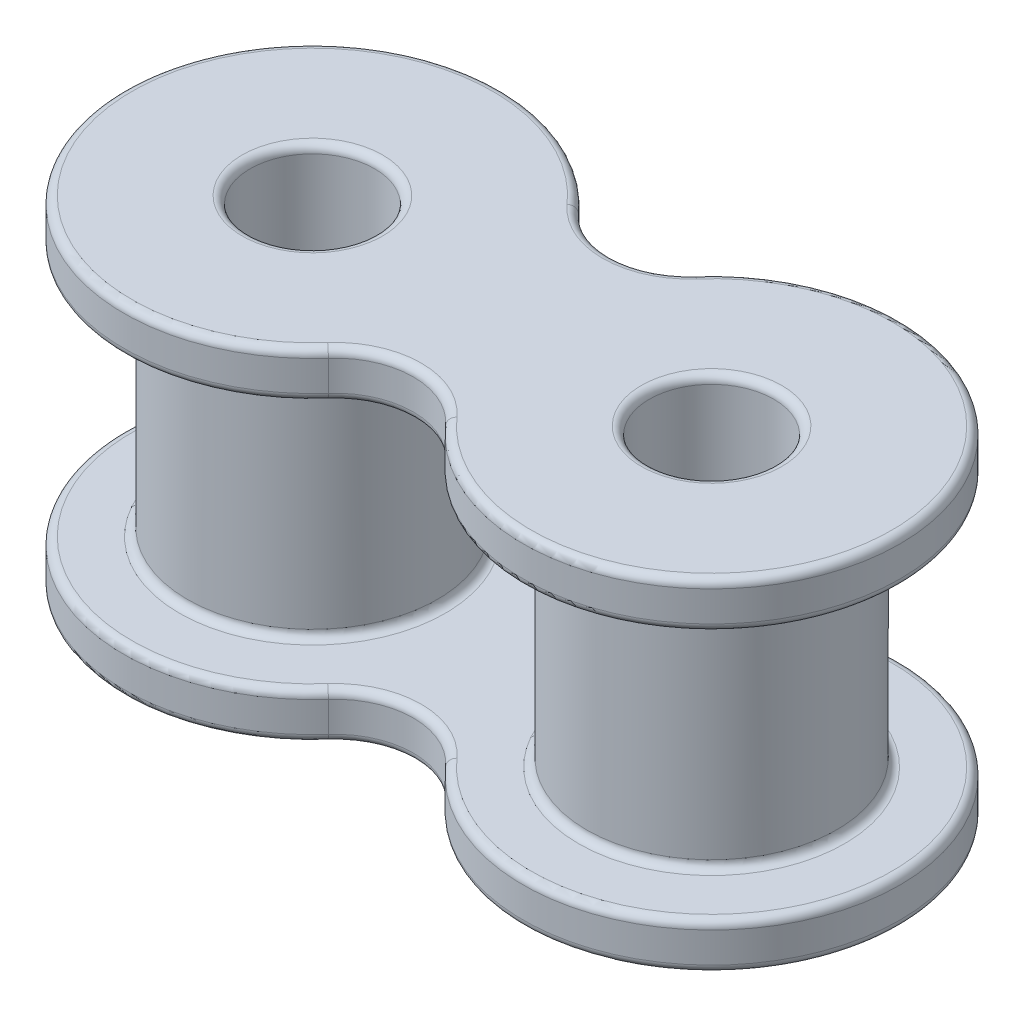
from build123d import *

# Parameters (mm, degrees)
SKETCH1_R             = 1.9812
BOSS_EXTRUDE1_DEPTH   = 0.7366
SKETCH5_R             = 3.9751
SKETCH5_R_2           = 1.9812
BOSS_EXTRUDE2_DEPTH   = 7.9248
FILLET_2_R            = 0.254
FILLET_2_OF_MIRROR2_R = 0.254


with BuildPart() as part:
    # Sketch1 → Boss-Extrude1 (new, symmetric)
    with BuildSketch(Plane(origin=(0, 0, 0), x_dir=(1, 0, 0), z_dir=(0, 1, 0))):
        with BuildLine():
            ThreePointArc((-1.865444619, 3.977636785), (-12.3444, 0), (-1.865444619, -3.977636785))
            ThreePointArc((-1.865444619, -3.977636785), (0, -3.138721939), (1.865444619, -3.977636785))
            ThreePointArc((1.865444619, -3.977636785), (12.3444, 0), (1.865444619, 3.977636785))
            ThreePointArc((1.865444619, 3.977636785), (0, 3.138721939), (-1.865444619, 3.977636785))
        make_face()
        with Locations((-6.35, 0)):
            Circle(SKETCH1_R, mode=Mode.SUBTRACT)
        with Locations((6.35, 0)):
            Circle(SKETCH1_R, mode=Mode.SUBTRACT)
    boss_extrude1 = extrude(amount=BOSS_EXTRUDE1_DEPTH, both=True)

    # Sketch5 → Boss-Extrude2 (add)
    # profile 1 of 2: a face of its own
    with BuildSketch(Plane(origin=(0, 0.7366, 0), x_dir=(1, 0, 0), z_dir=(0, 1, 0))):
        with Locations((6.35, 0)):
            Circle(SKETCH5_R)
        with Locations((6.35, 0)):
            Circle(SKETCH5_R_2, mode=Mode.SUBTRACT)
    # profile 2 of 2: a face of its own
    with BuildSketch(Plane(origin=(0, 0.7366, 0), x_dir=(1, 0, 0), z_dir=(0, 1, 0))):
        with Locations((-6.35, 0)):
            Circle(SKETCH5_R)
        with Locations((-6.35, 0)):
            Circle(SKETCH5_R_2, mode=Mode.SUBTRACT)
    extrude(amount=BOSS_EXTRUDE2_DEPTH)

    # Fillet 2
    fillet_2_edges = [part.edges().sort_by_distance(p)[0] for p in [
        (0, 0.7366, -3.138721939),
        (12.3444, 0.7366, 0),
        (0, 0.7366, 3.138721939),
        (-12.3444, -0.7366, 0),
        (0, -0.7366, -3.138721939),
        (-12.3444, 0.7366, 0),
        (4.3688, -0.7366, 0),
        (-8.3312, -0.7366, 0),
        (0, -0.7366, 3.138721939),
        (12.3444, -0.7366, 0),
        (2.3749, 0.7366, 0),
        (-10.3251, 0.7366, 0),
    ]]
    fillet(fillet_2_edges, radius=FILLET_2_R)

    # Mirror2: Boss-Extrude1 across plane
    add(boss_extrude1.mirror(Plane.ZX.offset(4.699)))

    # Fillet 2 of Mirror2
    fillet_2_of_mirror2_edges = [part.edges().sort_by_distance(p)[0] for p in [
        (0, 8.6614, -3.138721939),
        (12.3444, 8.6614, 0),
        (0, 8.6614, 3.138721939),
        (-12.3444, 10.1346, 0),
        (0, 10.1346, -3.138721939),
        (-12.3444, 8.6614, 0),
        (4.3688, 10.1346, 0),
        (-8.3312, 10.1346, 0),
        (0, 10.1346, 3.138721939),
        (12.3444, 10.1346, 0),
        (2.3749, 8.6614, 0),
        (-10.3251, 8.6614, 0),
    ]]
    fillet(fillet_2_of_mirror2_edges, radius=FILLET_2_OF_MIRROR2_R)


solid = part.part
